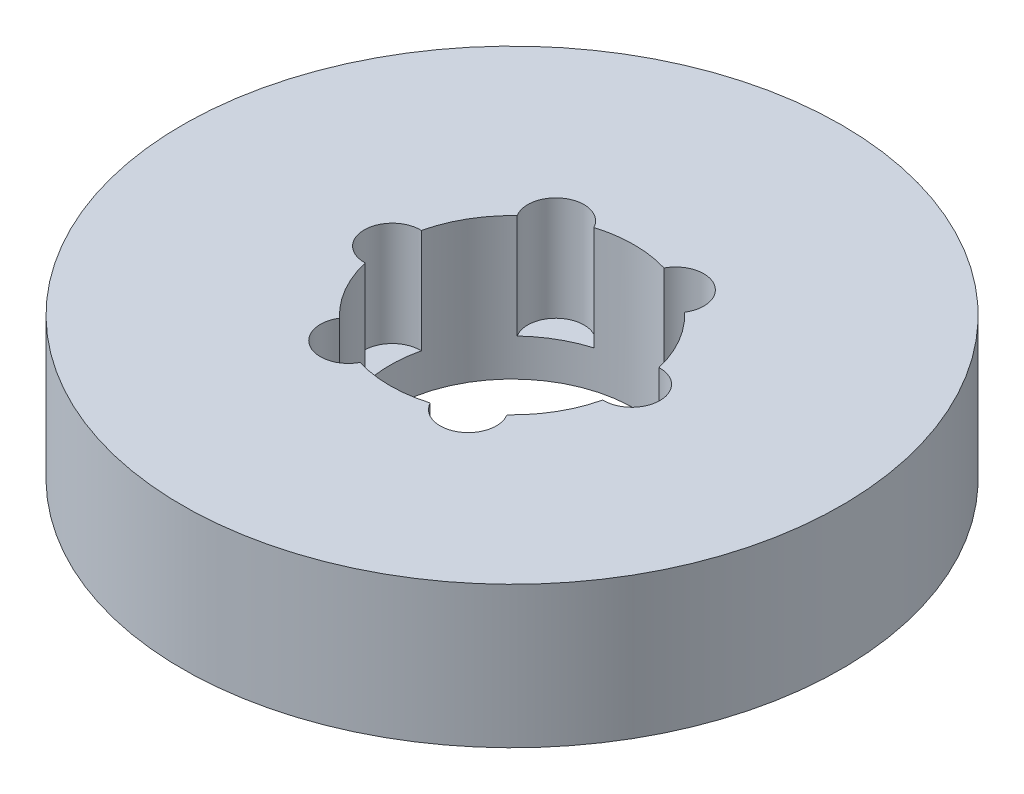
from build123d import *

# Parameters (mm, degrees)
SKETCH1_R           = 67.5
BOSS_EXTRUDE1_DEPTH = 29
SKETCH2_R           = 25
CUT_EXTRUDE1_DEPTH  = 100.767229089
SKETCH3_R           = 5.759428809
CUT_EXTRUDE2_DEPTH  = 21.356358463
CIRPATTERN1_COUNT   = 6


with BuildPart() as part:
    # Sketch1 → Boss-Extrude1 (new body)
    with BuildSketch(Plane(origin=(0, 0, 0), x_dir=(1, 0, 0), z_dir=(0, 1, 0))):
        Circle(SKETCH1_R)
    extrude(amount=BOSS_EXTRUDE1_DEPTH)

    # Sketch2 → Cut-Extrude1 (cut, through all)
    with BuildSketch(Plane(origin=(0, 0, 0), x_dir=(1, 0, 0), z_dir=(0, 1, 0))):
        Circle(SKETCH2_R)
    extrude(amount=CUT_EXTRUDE1_DEPTH, mode=Mode.SUBTRACT)

    # Sketch3 → Cut-Extrude2 (cut)
    with BuildSketch(Plane(origin=(0, 29, 0), x_dir=(1, 0, 0), z_dir=(0, 1, 0))):
        with Locations((-24.523558526, 0)):
            Circle(SKETCH3_R)
    cut_extrude2 = extrude(amount=-CUT_EXTRUDE2_DEPTH, mode=Mode.SUBTRACT)

    # CirPattern1: Cut-Extrude2 ×6 about axis
    cirpattern1_axis = Axis((0, 0, 0), (0, 1, 0))
    for i in range(1, CIRPATTERN1_COUNT):
        add(cut_extrude2.rotate(cirpattern1_axis, i * 360 / CIRPATTERN1_COUNT), mode=Mode.SUBTRACT)


solid = part.part
